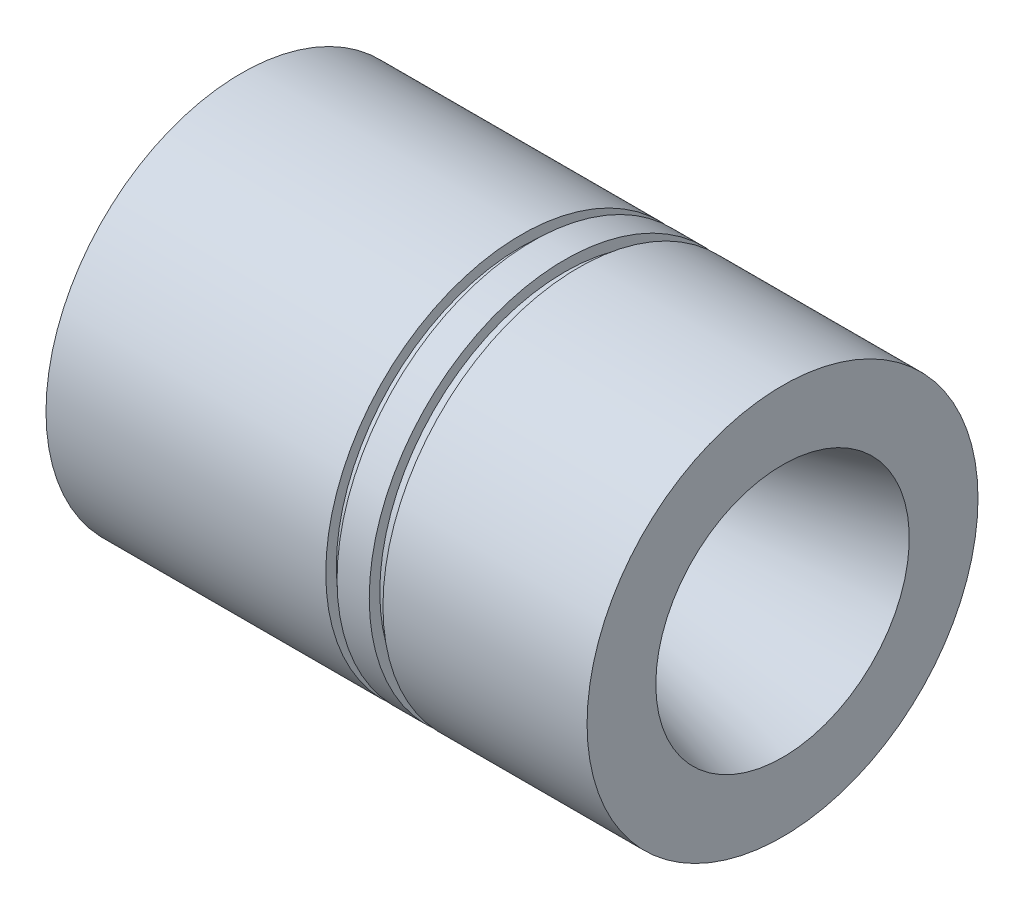
from build123d import *


with BuildPart() as part:
    # Sketch1 → Revolve1 (revolve)
    with BuildSketch(Plane.XY):
        with BuildLine():
            Line((43.421005762, 29.901440031), (63.302799643, 18.422680981))
            ThreePointArc((63.302799643, 18.422680981), (68.543849717, 16.213738545), (74.168, 15.367))
            ThreePointArc((74.168, 15.367), (75.003256616, 15.406217174), (75.824358548, 15.564277983))
            Line((75.824358548, 15.564277983), (140.97, 33.02))
            Line((140.97, 33.02), (140.97, 50.927))
            Line((140.97, 50.927), (87.788503876, 50.927))
            Line((87.788503876, 50.927), (87.788503876, 48.180233369))
            Line((87.788503876, 48.180233369), (84.218492297, 48.180233369))
            Line((84.218492297, 48.180233369), (84.218492297, 50.927))
            Line((84.218492297, 50.927), (75.824358548, 50.927))
            Line((75.824358548, 50.927), (75.824358548, 48.180233369))
            Line((75.824358548, 48.180233369), (72.892938323, 48.180233369))
            Line((72.892938323, 48.180233369), (72.892938323, 50.927))
            Line((72.892938323, 50.927), (0, 50.927))
            Line((0, 50.927), (0, 41.402))
            ThreePointArc((0, 41.402), (22.475975666, 38.541805218), (43.421005762, 29.901440031))
        make_face()
    revolve(axis=Axis((0, 0, 0), (1, 0, 0)))


solid = part.part
